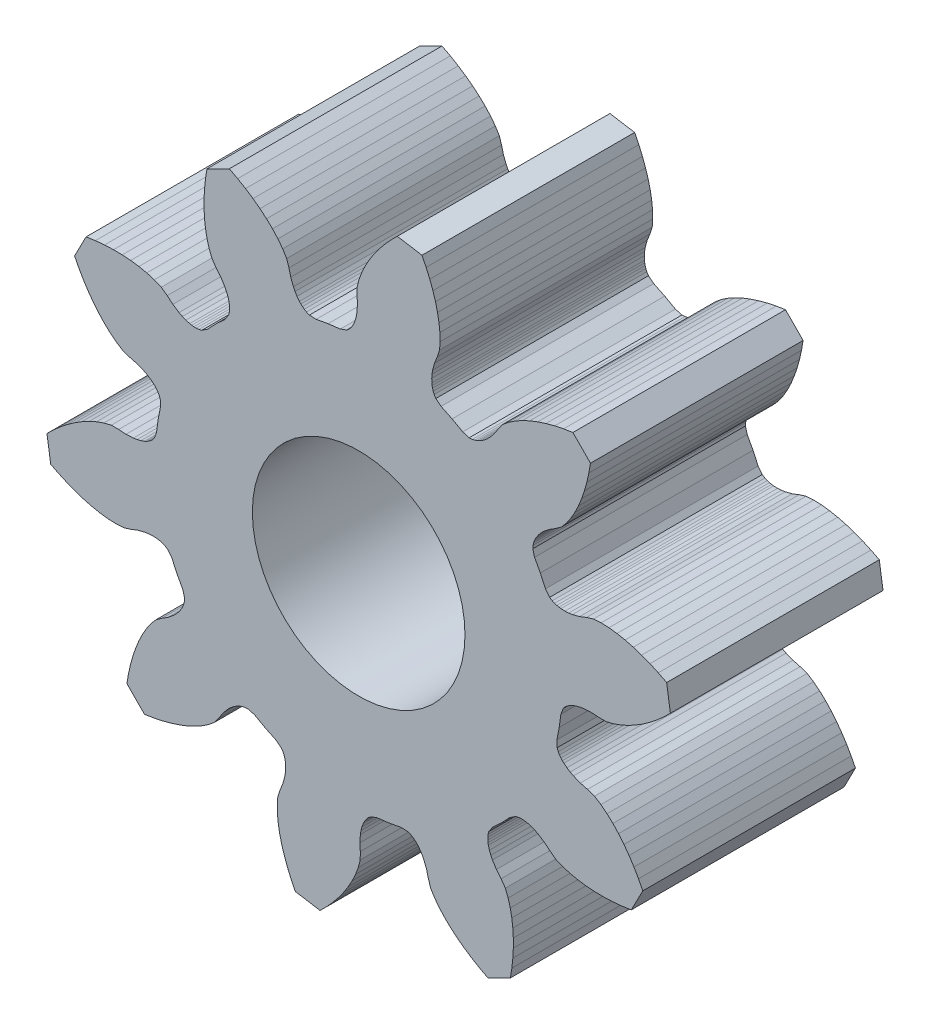
from build123d import *

# Parameters (mm, degrees)
EXTRUDE_GEAR_FACE_DEPTH = 10
SKETCH3_R               = 5
CUT_EXTRUDE1_DEPTH      = 24.004392687


with BuildPart() as part:
    # Sketch1 → Extrude gear face (new body)
    with BuildSketch(Plane.XY):
        Polygon((-8.785755588, -3.765027458), (-8.981475588, -3.515627458), (-9.104375588, -3.437067458), (-9.214815588, -3.388487458), (-9.318645588, -3.356197458), (-9.418135588, -3.334867458), (-9.514485588, -3.321697458), (-9.700295588, -3.313797458), (-9.879345588, -3.324657458), (-10.053295588, -3.350207458), (-10.389375588, -3.436367458), (-10.712795588, -3.560677458), (-11.043055588, -3.664357458), (-11.399975588, -3.686587458), (-11.767875588, -3.671647458), (-12.143785588, -3.625627458), (-12.525865588, -3.551357458), (-12.912635588, -3.450417458), (-13.302835588, -3.323837458), (-13.695295588, -3.172277458), (-14.088935588, -2.996237458), (-14.482675588, -2.796087458), (-14.659535588, -1.632117458), (-14.343025588, -1.324037458), (-14.019445588, -1.039017458), (-13.689715588, -0.777727458), (-13.354725588, -0.540947458), (-13.015395588, -0.329677458), (-12.672625588, -0.145267458), (-12.327345588, 0.010332542), (-11.980495588, 0.133882542), (-11.633085588, 0.218672542), (-11.286925588, 0.217772542), (-10.941175588, 0.195142542), (-10.594675588, 0.212702542), (-10.420995588, 0.239972542), (-10.246795588, 0.282782542), (-10.071725588, 0.345532542), (-9.983635588, 0.386722542), (-9.894965588, 0.436642542), (-9.805415588, 0.498312542), (-9.714385588, 0.577512542), (-9.620365588, 0.689032542), (-9.507565588, 0.985312542), (-9.431215588, 1.554652542), (-9.320805588, 2.118382542), (-9.332545588, 2.435192542), (-9.385805588, 2.570982542), (-9.446595588, 2.675212542), (-9.511615588, 2.762362542), (-9.579565588, 2.838102542), (-9.649775588, 2.905382542), (-9.795455588, 3.020992542), (-9.946695588, 3.117452542), (-10.102435588, 3.199022542), (-10.424975588, 3.326862542), (-10.759695588, 3.416392542), (-11.087825588, 3.526632542), (-11.389645588, 3.718442542), (-11.678495588, 3.946782542), (-11.955575588, 4.204962542), (-12.221015588, 4.489632542), (-12.474595588, 4.798622542), (-12.715865588, 5.130392542), (-12.944295588, 5.483682542), (-13.159275588, 5.857472542), (-13.360175588, 6.250842542), (-12.819095588, 7.296472542), (-12.381945588, 7.359662542), (-11.952645588, 7.400052542), (-11.532295588, 7.417632542), (-11.122115588, 7.412292542), (-10.723405588, 7.383762542), (-10.337705588, 7.331482542), (-9.966915588, 7.254412542), (-9.613685588, 7.150492542), (-9.282775588, 7.014882542), (-9.003265588, 6.810692542), (-8.736845588, 6.589162542), (-8.446195588, 6.399692542), (-8.289655588, 6.319672542), (-8.123565588, 6.251912542), (-7.945045588, 6.199772542), (-7.849565588, 6.181312542), (-7.748485588, 6.169592542), (-7.639795588, 6.166842542), (-7.519595588, 6.177412542), (-7.377995588, 6.212372542), (-7.112585588, 6.385762542), (-6.716155588, 6.801492542), (-6.295475588, 7.192662542), (-6.118765588, 7.455872542), (-6.082035588, 7.597022542), (-6.069955588, 7.717082542), (-6.071335588, 7.825802542), (-6.081785588, 7.927022542), (-6.099045588, 8.022722542), (-6.148945588, 8.201882542), (-6.214605588, 8.368812542), (-6.292655588, 8.526342542), (-6.478445588, 8.819352542), (-6.696615588, 9.088532542), (-6.897285588, 9.370582542), (-7.028725588, 9.703172542), (-7.128195588, 10.057682542), (-7.200595588, 10.429412542), (-7.248025588, 10.815742542), (-7.271545588, 11.214772542), (-7.271735588, 11.624992542), (-7.248875588, 12.045082542), (-7.203095588, 12.473852542), (-7.134405588, 12.910172542), (-6.082065588, 13.438062542), (-5.691255588, 13.232242542), (-5.320195588, 13.012582542), (-4.969795588, 12.779732542), (-4.641085588, 12.534302542), (-4.335305588, 12.276862542), (-4.053995588, 12.007862542), (-3.799315588, 11.727562542), (-3.574625588, 11.435872542), (-3.386625588, 11.131662542), (-3.280515588, 10.802172542), (-3.195195588, 10.466352542), (-3.071425588, 10.142232542), (-2.991815588, 9.985472542), (-2.897265588, 9.833042542), (-2.783495588, 9.685922542), (-2.717095588, 9.614872542), (-2.642215588, 9.545972542), (-2.555895588, 9.479852542), (-2.452435588, 9.417762542), (-2.317335588, 9.362802542), (-2.000695588, 9.347082542), (-1.435615588, 9.450402542), (-0.865355588, 9.519592542), (-0.567685588, 9.628662542), (-0.454995588, 9.721272542), (-0.374655588, 9.811292542), (-0.311875588, 9.900062542), (-0.260835588, 9.988102542), (-0.218545588, 10.075662542), (-0.153605588, 10.249942542), (-0.108605588, 10.423582542), (-0.079155588, 10.596902542), (-0.057245588, 10.943162542), (-0.075525588, 11.289172542), (-0.072075588, 11.635302542), (0.017074412, 11.981632542), (0.144974412, 12.326902542), (0.304904412, 12.670202542), (0.493604412, 13.010622542), (0.709124412, 13.347272542), (0.950094412, 13.679252542), (1.215504412, 14.005682542), (1.504574412, 14.325642542), (1.816604412, 14.638262542), (2.978254412, 14.446792542), (3.173444412, 14.050562542), (3.344524412, 13.654752542), (3.491134412, 13.260412542), (3.612814412, 12.868652542), (3.708874412, 12.480642542), (3.778344412, 12.097662542), (3.819634412, 11.721202542), (3.829954412, 11.353142542), (3.803234412, 10.996532542), (3.695414412, 10.667602542), (3.567044412, 10.345762542), (3.476674412, 10.010792542), (3.448934412, 9.837182542), (3.435824412, 9.658292542), (3.441394412, 9.472392542), (3.453354412, 9.375882542), (3.473434412, 9.276122542), (3.504404412, 9.171902542), (3.551604412, 9.060862542), (3.628614412, 8.936982542), (3.875534412, 8.738142542), (4.393414412, 8.489592542), (4.895434412, 8.210382542), (5.200374412, 8.123652542), (5.345974412, 8.132332542), (5.463884412, 8.157942542), (5.566854412, 8.192852542), (5.659894412, 8.234072542), (5.745574412, 8.280062542), (5.900544412, 8.382882542), (6.039014412, 8.496912542), (6.164724412, 8.619822542), (6.385974412, 8.887072542), (6.574564412, 9.177742542), (6.780804412, 9.455742542), (7.056494412, 9.683522542), (7.362904412, 9.887682542), (7.694074412, 10.071412542), (8.046834412, 10.235892542), (8.419074412, 10.381572542), (8.809154412, 10.508522542), (9.215754412, 10.616592542), (9.637674412, 10.705542542), (10.073864412, 10.775052542), (10.901124412, 9.937342542), (10.826134412, 9.502062542), (10.731884412, 9.081282542), (10.618714412, 8.676082542), (10.486874412, 8.287622542), (10.336534412, 7.917252542), (10.167624412, 7.566582542), (9.979744412, 7.237742542), (9.771754412, 6.933922542), (9.540534412, 6.661112542), (9.259954412, 6.458382542), (8.966944412, 6.273462542), (8.696934412, 6.055582542), (8.572454412, 5.931432542), (8.456694412, 5.794412542), (8.351934412, 5.640742542), (8.304874412, 5.555642542), (8.262484412, 5.463132542), (8.226284412, 5.360602542), (8.199204412, 5.243022542), (8.188684412, 5.097542542), (8.271574412, 4.791552542), (8.544454412, 4.286062542), (8.786484412, 3.765092542), (8.982204412, 3.515692542), (9.105104412, 3.437132542), (9.215544412, 3.388542542), (9.319364412, 3.356262542), (9.418864412, 3.334932542), (9.515214412, 3.321762542), (9.701024412, 3.313862542), (9.880074412, 3.324722542), (10.054014412, 3.350272542), (10.390094412, 3.436432542), (10.713524412, 3.560732542), (11.043784412, 3.664422542), (11.400704412, 3.686652542), (11.768604412, 3.671712542), (12.144514412, 3.625692542), (12.526594412, 3.551422542), (12.913364412, 3.450482542), (13.303564412, 3.323902542), (13.696024412, 3.172342542), (14.089654412, 2.996302542), (14.483404412, 2.796152542), (14.660264412, 1.632182542), (14.343754412, 1.324102542), (14.020174412, 1.039082542), (13.690444412, 0.777792542), (13.355454412, 0.541012542), (13.016124412, 0.329742542), (12.673354412, 0.145332542), (12.328074412, -0.010267458), (11.981224412, -0.133817458), (11.633804412, -0.218607458), (11.287654412, -0.217707458), (10.941904412, -0.195077458), (10.595404412, -0.212637458), (10.421724412, -0.239907458), (10.247524412, -0.282727458), (10.072454412, -0.345467458), (9.984364412, -0.386657458), (9.895694412, -0.436577458), (9.806144412, -0.498247458), (9.715114412, -0.577447458), (9.621094412, -0.688967458), (9.508294412, -0.985247458), (9.431944412, -1.554587458), (9.321524412, -2.118327458), (9.333274412, -2.435137458), (9.386524412, -2.570917458), (9.447314412, -2.675147458), (9.512344412, -2.762297458), (9.580294412, -2.838037458), (9.650504412, -2.905317458), (9.796184412, -3.020937458), (9.947424412, -3.117387458), (10.103164412, -3.198957458), (10.425704412, -3.326797458), (10.760424412, -3.416337458), (11.088554412, -3.526567458), (11.390374412, -3.718377458), (11.679224412, -3.946717458), (11.956304412, -4.204897458), (12.221744412, -4.489567458), (12.475324412, -4.798557458), (12.716594412, -5.130327458), (12.945024412, -5.483627458), (13.160004412, -5.857417458), (13.360904412, -6.250777458), (12.819824412, -7.296407458), (12.382674412, -7.359597458), (11.953364412, -7.399997458), (11.533024412, -7.417577458), (11.122844412, -7.412227458), (10.724134412, -7.383697458), (10.338434412, -7.331417458), (9.967634412, -7.254347458), (9.614404412, -7.150427458), (9.283504412, -7.014817458), (9.003994412, -6.810627458), (8.737574412, -6.589097458), (8.446924412, -6.399627458), (8.290384412, -6.319607458), (8.124294412, -6.251857458), (7.945774412, -6.199707458), (7.850294412, -6.181247458), (7.749214412, -6.169527458), (7.640524412, -6.166777458), (7.520324412, -6.177347458), (7.378714412, -6.212307458), (7.113314412, -6.385697458), (6.716884412, -6.801427458), (6.296204412, -7.192597458), (6.119494412, -7.455807458), (6.082764412, -7.596967458), (6.070674412, -7.717017458), (6.072064412, -7.825737458), (6.082514412, -7.926957458), (6.099774412, -8.022657458), (6.149674412, -8.201817458), (6.215324412, -8.368747458), (6.293384412, -8.526277458), (6.479174412, -8.819287458), (6.697344412, -9.088467458), (6.898014412, -9.370527458), (7.029444412, -9.703107458), (7.128924412, -10.057617458), (7.201324412, -10.429347458), (7.248754412, -10.815677458), (7.272274412, -11.214707458), (7.272464412, -11.624927458), (7.249604412, -12.045017458), (7.203824412, -12.473787458), (7.135134412, -12.910107458), (6.082784412, -13.437997458), (5.691984412, -13.232177458), (5.320924412, -13.012517458), (4.970524412, -12.779667458), (4.641814412, -12.534247458), (4.336034412, -12.276807458), (4.054724412, -12.007797458), (3.800044412, -11.727507458), (3.575354412, -11.435807458), (3.387354412, -11.131597458), (3.281244412, -10.802107458), (3.195924412, -10.466287458), (3.072154412, -10.142167458), (2.992544412, -9.985417458), (2.897994412, -9.832977458), (2.784224412, -9.685857458), (2.717824412, -9.614807458), (2.642944412, -9.545907458), (2.556624412, -9.479797458), (2.453164412, -9.417697458), (2.318054412, -9.362737458), (2.001424412, -9.347017458), (1.436344412, -9.450337458), (0.866084412, -9.519527458), (0.568414412, -9.628597458), (0.455724412, -9.721207458), (0.375384412, -9.811227458), (0.312594412, -9.899997458), (0.261564412, -9.988037458), (0.219264412, -10.075597458), (0.154334412, -10.249877458), (0.109334412, -10.423517458), (0.079874412, -10.596847458), (0.057964412, -10.943097458), (0.076244412, -11.289107458), (0.072804412, -11.635237458), (-0.016345588, -11.981567458), (-0.144245588, -12.326837458), (-0.304175588, -12.670137458), (-0.492885588, -13.010557458), (-0.708395588, -13.347207458), (-0.949365588, -13.679187458), (-1.214785588, -14.005617458), (-1.503845588, -14.325587458), (-1.815875588, -14.638207458), (-2.977525588, -14.446727458), (-3.172715588, -14.050497458), (-3.343795588, -13.654687458), (-3.490405588, -13.260347458), (-3.612085588, -12.868587458), (-3.708145588, -12.480577458), (-3.777615588, -12.097597458), (-3.818905588, -11.721137458), (-3.829225588, -11.353077458), (-3.802515588, -10.996467458), (-3.694685588, -10.667537458), (-3.566325588, -10.345697458), (-3.475945588, -10.010727458), (-3.448205588, -9.837117458), (-3.435095588, -9.658227458), (-3.440675588, -9.472327458), (-3.452625588, -9.375817458), (-3.472705588, -9.276067458), (-3.503685588, -9.171837458), (-3.550875588, -9.060797458), (-3.627885588, -8.936917458), (-3.874805588, -8.738077458), (-4.392685588, -8.489527458), (-4.894715588, -8.210317458), (-5.199645588, -8.123587458), (-5.345245588, -8.132277458), (-5.463155588, -8.157877458), (-5.566125588, -8.192787458), (-5.659165588, -8.234017458), (-5.744845588, -8.279997458), (-5.899815588, -8.382817458), (-6.038285588, -8.496847458), (-6.163995588, -8.619757458), (-6.385245588, -8.887007458), (-6.573835588, -9.177677458), (-6.780075588, -9.455677458), (-7.055765588, -9.683457458), (-7.362185588, -9.887617458), (-7.693345588, -10.071347458), (-8.046115588, -10.235837458), (-8.418345588, -10.381517458), (-8.808425588, -10.508457458), (-9.215025588, -10.616527458), (-9.636955588, -10.705487458), (-10.073145588, -10.774987458), (-10.900395588, -9.937277458), (-10.825405588, -9.501997458), (-10.731165588, -9.081217458), (-10.617985588, -8.676017458), (-10.486155588, -8.287557458), (-10.335805588, -7.917187458), (-10.166895588, -7.566517458), (-9.979015588, -7.237687458), (-9.771035588, -6.933857458), (-9.539805588, -6.661047458), (-9.259225588, -6.458317458), (-8.966215588, -6.273397458), (-8.696205588, -6.055527458), (-8.571725588, -5.931367458), (-8.455965588, -5.794347458), (-8.351205588, -5.640677458), (-8.304145588, -5.555577458), (-8.261755588, -5.463067458), (-8.225555588, -5.360537458), (-8.198475588, -5.242957458), (-8.187955588, -5.097487458), (-8.270845588, -4.791487458), (-8.543725588, -4.285997458), align=None)
    extrude(amount=EXTRUDE_GEAR_FACE_DEPTH)

    # Sketch3 → Cut-Extrude1 (cut, through all)
    with BuildSketch(Plane(origin=(0, 0, 0), x_dir=(-1, 0, 0), z_dir=(0, 0, -1))):
        Circle(SKETCH3_R)
    extrude(amount=-CUT_EXTRUDE1_DEPTH, mode=Mode.SUBTRACT)


solid = part.part
